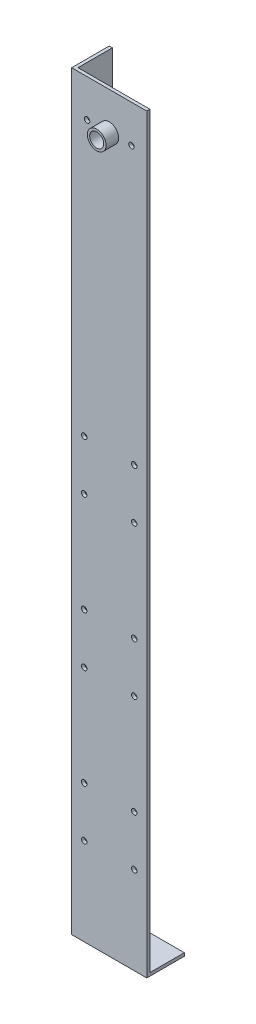
from build123d import *

# Parameters (mm, degrees)
SKETCH1_W           = 152.4
SKETCH1_H           = 76.2
BOSS_EXTRUDE1_DEPTH = 1524
CUT_EXTRUDE1_REACH  = 1529.805
SKETCH2_R           = 6.35
SKETCH4_R           = 19.05
SKETCH4_R_2         = 14.2875
BOSS_EXTRUDE2_DEPTH = 25.4
CUT_EXTRUDE3_REACH  = 1529.225
SKETCH7_W           = 152.4
SKETCH7_H           = 76.2
BOSS_EXTRUDE3_DEPTH = 6.35
CUT_EXTRUDE4_REACH  = 1529.502
SKETCH8_R           = 5.55625
CUT_EXTRUDE5_REACH  = 1529.805
SKETCH9_R           = 5.55625


with BuildPart() as part:
    # Sketch1 → Boss-Extrude1 (new body)
    with BuildSketch(Plane(origin=(0, 0, 0), x_dir=(1, 0, 0), z_dir=(0, 1, 0))):
        Rectangle(SKETCH1_W, SKETCH1_H)
    extrude(amount=BOSS_EXTRUDE1_DEPTH)

    # Sketch2 → Cut-Extrude1 (cut, up to next)
    with BuildSketch(Plane.XY.offset(38.1), mode=Mode.PRIVATE) as cut_extrude1_sk1:
        with Locations((0, 1447.8)):
            Circle(SKETCH2_R)
    cut_extrude1_tool1 = extrude(cut_extrude1_sk1.sketch, amount=-CUT_EXTRUDE1_REACH, mode=Mode.PRIVATE) & part.part
    add(cut_extrude1_tool1.solids().sort_by_distance((0, 1447.8, 38.1))[0], mode=Mode.SUBTRACT)

    # Sketch4 → Boss-Extrude2 (add)
    with BuildSketch(Plane.XY.offset(38.1)):
        with Locations((0, 1447.8)):
            Circle(SKETCH4_R)
        with Locations((0, 1447.8)):
            Circle(SKETCH4_R_2, mode=Mode.SUBTRACT)
    extrude(amount=BOSS_EXTRUDE2_DEPTH)

    # Sketch5 → Cut-Extrude3 (cut, up to next)
    with BuildSketch(Plane(origin=(0, 1524, 0), x_dir=(1, 0, 0), z_dir=(0, 1, 0)), mode=Mode.PRIVATE) as cut_extrude3_sk1:
        Polygon((-69.85, 31.75), (-69.85, 38.1), (76.2, 38.1), (76.2, -31.75), (69.85, -31.75), (-69.85, -31.75), align=None)
    cut_extrude3_tool1 = extrude(cut_extrude3_sk1.sketch, amount=-CUT_EXTRUDE3_REACH, mode=Mode.PRIVATE) & part.part
    add(cut_extrude3_tool1.solids().sort_by_distance((3.175, 1524, -3.175))[0], mode=Mode.SUBTRACT)

    # Sketch7 → Boss-Extrude3 (add)
    with BuildSketch(Plane.XZ):
        Rectangle(SKETCH7_W, SKETCH7_H)
    extrude(amount=-BOSS_EXTRUDE3_DEPTH)

    # Sketch8 → Cut-Extrude4 (cut, up to next)
    with BuildSketch(Plane(origin=(0, 0, 31.75), x_dir=(-1, 0, 0), z_dir=(0, 0, -1)), mode=Mode.PRIVATE) as cut_extrude4_sk1:
        with Locations((45.0453125, 1447.8)):
            Circle(SKETCH8_R)
    cut_extrude4_tool1 = extrude(cut_extrude4_sk1.sketch, amount=-CUT_EXTRUDE4_REACH, mode=Mode.PRIVATE) & part.part
    # Sketch8 → Cut-Extrude4 (cut, up to next)
    with BuildSketch(Plane(origin=(0, 0, 31.75), x_dir=(-1, 0, 0), z_dir=(0, 0, -1)), mode=Mode.PRIVATE) as cut_extrude4_sk2:
        with Locations((-45.0453125, 1447.8)):
            Circle(SKETCH8_R)
    cut_extrude4_tool2 = extrude(cut_extrude4_sk2.sketch, amount=-CUT_EXTRUDE4_REACH, mode=Mode.PRIVATE) & part.part
    add(cut_extrude4_tool1.solids().sort_by_distance((-45.045312, 1447.8, 31.75))[0], mode=Mode.SUBTRACT)
    add(cut_extrude4_tool2.solids().sort_by_distance((45.045313, 1447.8, 31.75))[0], mode=Mode.SUBTRACT)

    # Sketch9 → Cut-Extrude5 (cut, up to next)
    with BuildSketch(Plane.XY.offset(38.1), mode=Mode.PRIVATE) as cut_extrude5_sk1:
        with Locations((-50.8, 279.4)):
            Circle(SKETCH9_R)
    cut_extrude5_tool1 = extrude(cut_extrude5_sk1.sketch, amount=-CUT_EXTRUDE5_REACH, mode=Mode.PRIVATE) & part.part
    # Sketch9 → Cut-Extrude5 (cut, up to next)
    with BuildSketch(Plane.XY.offset(38.1), mode=Mode.PRIVATE) as cut_extrude5_sk2:
        with Locations((50.8, 279.4)):
            Circle(SKETCH9_R)
    cut_extrude5_tool2 = extrude(cut_extrude5_sk2.sketch, amount=-CUT_EXTRUDE5_REACH, mode=Mode.PRIVATE) & part.part
    # Sketch9 → Cut-Extrude5 (cut, up to next)
    with BuildSketch(Plane.XY.offset(38.1), mode=Mode.PRIVATE) as cut_extrude5_sk3:
        with Locations((50.8, 177.8)):
            Circle(SKETCH9_R)
    cut_extrude5_tool3 = extrude(cut_extrude5_sk3.sketch, amount=-CUT_EXTRUDE5_REACH, mode=Mode.PRIVATE) & part.part
    # Sketch9 → Cut-Extrude5 (cut, up to next)
    with BuildSketch(Plane.XY.offset(38.1), mode=Mode.PRIVATE) as cut_extrude5_sk4:
        with Locations((-50.8, 177.8)):
            Circle(SKETCH9_R)
    cut_extrude5_tool4 = extrude(cut_extrude5_sk4.sketch, amount=-CUT_EXTRUDE5_REACH, mode=Mode.PRIVATE) & part.part
    # Sketch9 → Cut-Extrude5 (cut, up to next)
    with BuildSketch(Plane.XY.offset(38.1), mode=Mode.PRIVATE) as cut_extrude5_sk5:
        with Locations((-50.8, 482.6)):
            Circle(SKETCH9_R)
    cut_extrude5_tool5 = extrude(cut_extrude5_sk5.sketch, amount=-CUT_EXTRUDE5_REACH, mode=Mode.PRIVATE) & part.part
    # Sketch9 → Cut-Extrude5 (cut, up to next)
    with BuildSketch(Plane.XY.offset(38.1), mode=Mode.PRIVATE) as cut_extrude5_sk6:
        with Locations((50.8, 482.6)):
            Circle(SKETCH9_R)
    cut_extrude5_tool6 = extrude(cut_extrude5_sk6.sketch, amount=-CUT_EXTRUDE5_REACH, mode=Mode.PRIVATE) & part.part
    # Sketch9 → Cut-Extrude5 (cut, up to next)
    with BuildSketch(Plane.XY.offset(38.1), mode=Mode.PRIVATE) as cut_extrude5_sk7:
        with Locations((-50.8, 584.2)):
            Circle(SKETCH9_R)
    cut_extrude5_tool7 = extrude(cut_extrude5_sk7.sketch, amount=-CUT_EXTRUDE5_REACH, mode=Mode.PRIVATE) & part.part
    # Sketch9 → Cut-Extrude5 (cut, up to next)
    with BuildSketch(Plane.XY.offset(38.1), mode=Mode.PRIVATE) as cut_extrude5_sk8:
        with Locations((50.8, 584.2)):
            Circle(SKETCH9_R)
    cut_extrude5_tool8 = extrude(cut_extrude5_sk8.sketch, amount=-CUT_EXTRUDE5_REACH, mode=Mode.PRIVATE) & part.part
    # Sketch9 → Cut-Extrude5 (cut, up to next)
    with BuildSketch(Plane.XY.offset(38.1), mode=Mode.PRIVATE) as cut_extrude5_sk9:
        with Locations((-50.8, 787.4)):
            Circle(SKETCH9_R)
    cut_extrude5_tool9 = extrude(cut_extrude5_sk9.sketch, amount=-CUT_EXTRUDE5_REACH, mode=Mode.PRIVATE) & part.part
    # Sketch9 → Cut-Extrude5 (cut, up to next)
    with BuildSketch(Plane.XY.offset(38.1), mode=Mode.PRIVATE) as cut_extrude5_sk10:
        with Locations((50.8, 787.4)):
            Circle(SKETCH9_R)
    cut_extrude5_tool10 = extrude(cut_extrude5_sk10.sketch, amount=-CUT_EXTRUDE5_REACH, mode=Mode.PRIVATE) & part.part
    # Sketch9 → Cut-Extrude5 (cut, up to next)
    with BuildSketch(Plane.XY.offset(38.1), mode=Mode.PRIVATE) as cut_extrude5_sk11:
        with Locations((50.8, 889)):
            Circle(SKETCH9_R)
    cut_extrude5_tool11 = extrude(cut_extrude5_sk11.sketch, amount=-CUT_EXTRUDE5_REACH, mode=Mode.PRIVATE) & part.part
    # Sketch9 → Cut-Extrude5 (cut, up to next)
    with BuildSketch(Plane.XY.offset(38.1), mode=Mode.PRIVATE) as cut_extrude5_sk12:
        with Locations((-50.8, 889)):
            Circle(SKETCH9_R)
    cut_extrude5_tool12 = extrude(cut_extrude5_sk12.sketch, amount=-CUT_EXTRUDE5_REACH, mode=Mode.PRIVATE) & part.part
    add(cut_extrude5_tool1.solids().sort_by_distance((-50.8, 279.4, 38.1))[0], mode=Mode.SUBTRACT)
    add(cut_extrude5_tool2.solids().sort_by_distance((50.8, 279.4, 38.1))[0], mode=Mode.SUBTRACT)
    add(cut_extrude5_tool3.solids().sort_by_distance((50.8, 177.8, 38.1))[0], mode=Mode.SUBTRACT)
    add(cut_extrude5_tool4.solids().sort_by_distance((-50.8, 177.8, 38.1))[0], mode=Mode.SUBTRACT)
    add(cut_extrude5_tool5.solids().sort_by_distance((-50.8, 482.6, 38.1))[0], mode=Mode.SUBTRACT)
    add(cut_extrude5_tool6.solids().sort_by_distance((50.8, 482.6, 38.1))[0], mode=Mode.SUBTRACT)
    add(cut_extrude5_tool7.solids().sort_by_distance((-50.8, 584.2, 38.1))[0], mode=Mode.SUBTRACT)
    add(cut_extrude5_tool8.solids().sort_by_distance((50.8, 584.2, 38.1))[0], mode=Mode.SUBTRACT)
    add(cut_extrude5_tool9.solids().sort_by_distance((-50.8, 787.4, 38.1))[0], mode=Mode.SUBTRACT)
    add(cut_extrude5_tool10.solids().sort_by_distance((50.8, 787.4, 38.1))[0], mode=Mode.SUBTRACT)
    add(cut_extrude5_tool11.solids().sort_by_distance((50.8, 889, 38.1))[0], mode=Mode.SUBTRACT)
    add(cut_extrude5_tool12.solids().sort_by_distance((-50.8, 889, 38.1))[0], mode=Mode.SUBTRACT)


solid = part.part
